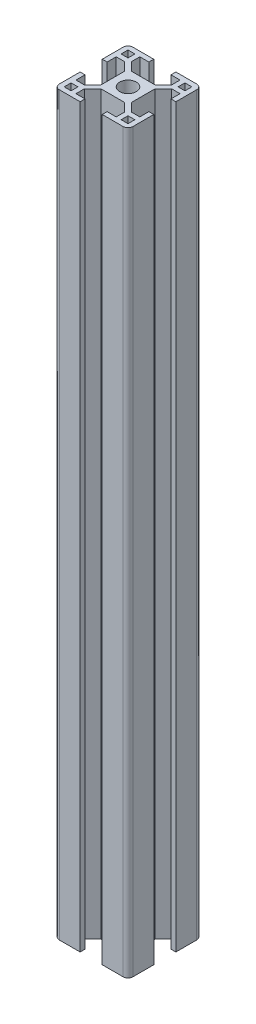
from build123d import *

# Parameters (mm, degrees)
SKETCH1_W           = 20
SKETCH1_H           = 20
EXTRUDE1_DEPTH      = 200
SKETCH2_R           = 2.266666667
SKETCH2_W           = 1.866666667
SKETCH2_H           = 1.866666667
EXTRUDE2_DEPTH      = 201.499376558
FILLET1_R           = 1.333333333
SKETCH_1_R          = 2.5
CUT_EXTRUDE_1_DEPTH = 202.246117975


with BuildPart() as part:
    # Sketch1 → Extrude1 (new body)
    with BuildSketch(Plane(origin=(0, 0, 0), x_dir=(1, 0, 0), z_dir=(0, 1, 0))):
        Rectangle(SKETCH1_W, SKETCH1_H)
    extrude(amount=EXTRUDE1_DEPTH)

    # Sketch2 → Extrude2 (cut, through all)
    with BuildSketch(Plane(origin=(0, 200, 0), x_dir=(1, 0, 0), z_dir=(0, 1, 0))):
        Circle(SKETCH2_R)
        Polygon((8.666666667, 3), (11.333333333, 3), (11.333333333, -3), (8.666666667, -3), (8.666666667, -5.466666667), (6.409475708, -5.466666667), (4.133333333, -3.190524292), (4.133333333, 3.190524292), (6.409475708, 5.466666667), (8.666666667, 5.466666667), align=None)
        with Locations((7.733333334, 7.733333334)):
            Rectangle(SKETCH2_W, SKETCH2_H)
        Polygon((-3.190524292, 4.133333333), (-5.466666667, 6.409475708), (-5.466666667, 8.666666667), (-3, 8.666666667), (-3, 11.333333333), (3, 11.333333333), (3, 8.666666667), (5.466666667, 8.666666667), (5.466666667, 6.409475708), (3.190524292, 4.133333333), align=None)
        with Locations((7.733333334, -7.733333334)):
            Rectangle(SKETCH2_W, SKETCH2_H)
        with Locations((-7.733333334, 7.733333334)):
            Rectangle(SKETCH2_W, SKETCH2_H)
        with Locations((-7.733333334, -7.733333334)):
            Rectangle(SKETCH2_W, SKETCH2_H)
        Polygon((-6.409475708, -5.466666667), (-8.666666667, -5.466666667), (-8.666666667, -3), (-11.333333333, -3), (-11.333333333, 3), (-8.666666667, 3), (-8.666666667, 5.466666667), (-6.409475708, 5.466666667), (-4.133333333, 3.190524292), (-4.133333333, -3.190524292), align=None)
        Polygon((3.190524292, -4.133333333), (-3.190524292, -4.133333333), (-5.466666667, -6.409475708), (-5.466666667, -8.666666667), (-3, -8.666666667), (-3, -11.333333333), (3, -11.333333333), (3, -8.666666667), (5.466666667, -8.666666667), (5.466666667, -6.409475708), align=None)
    extrude(amount=-EXTRUDE2_DEPTH, mode=Mode.SUBTRACT)

    # Fillet1
    fillet1_edges = [part.edges().sort_by_distance(p)[0] for p in [
        (10, 100, 10),
        (10, 100, -10),
        (-10, 100, 10),
        (-10, 100, -10),
    ]]
    fillet(fillet1_edges, radius=FILLET1_R)

    # Эскиз1 → Вырез-Вытянуть1 (cut, through all)
    with BuildSketch(Plane(origin=(10, 0, 0), x_dir=(0, 0, -1), z_dir=(1, 0, 0))):
        with Locations((0, 43)):
            Circle(SKETCH_1_R)
        with Locations((0, 57)):
            Circle(SKETCH_1_R)
    extrude(amount=-CUT_EXTRUDE_1_DEPTH, mode=Mode.SUBTRACT)


solid = part.part
